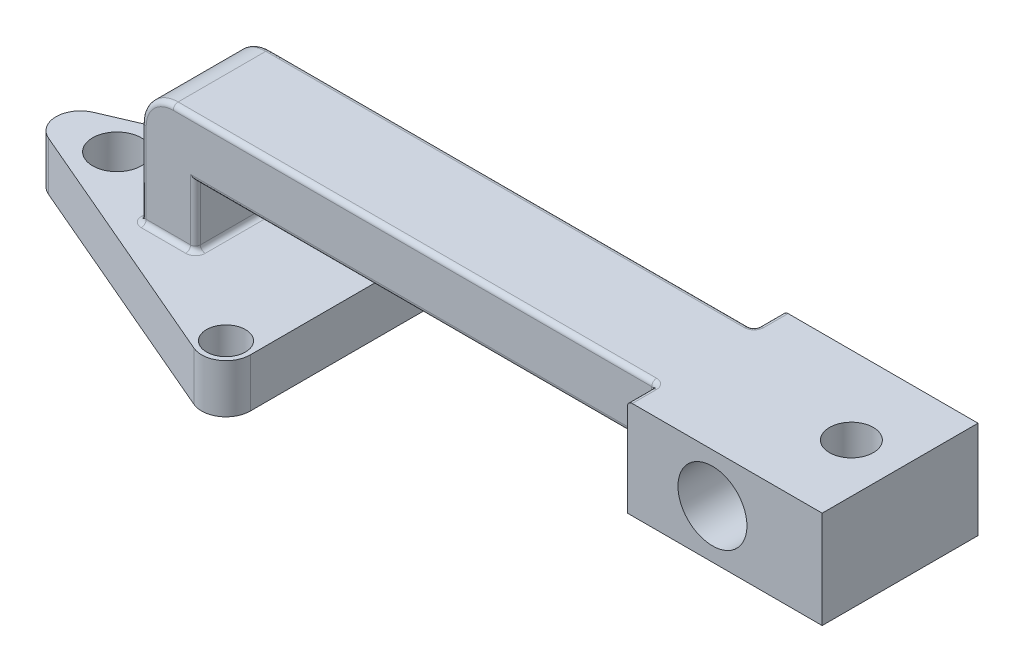
from build123d import *

# Parameters (mm, degrees)
BOSS_EXTRUDE1_DEPTH = 10
FILLET1_R           = 5
SKETCH2_R           = 5
SKETCH2_R_2         = 4
CUT_EXTRUDE1_DEPTH  = 20
BOSS_EXTRUDE2_DEPTH = 10
SKETCH6_W           = 32
SKETCH6_H           = 20
BOSS_EXTRUDE3_DEPTH = 40
SKETCH8_R           = 7.085047893
CUT_EXTRUDE3_DEPTH  = 40
FILLET5_R           = 1
SKETCH9_R           = 4.5
CUT_EXTRUDE4_DEPTH  = 40


with BuildPart() as part:
    # Sketch1 → Boss-Extrude1 (new body)
    with BuildSketch(Plane(origin=(0, 0, 0), x_dir=(1, 0, 0), z_dir=(0, 1, 0))):
        Polygon((0, 30), (0, -30), (-70, 0), align=None)
    extrude(amount=BOSS_EXTRUDE1_DEPTH)

    # Fillet1
    fillet1_edges = [part.edges().sort_by_distance(p)[0] for p in [
        (-70, 5, 0),
        (0, 5, -30),
        (0, 5, 30),
    ]]
    fillet(fillet1_edges, radius=FILLET1_R)

    # Sketch2 → Cut-Extrude1 (cut)
    with BuildSketch(Plane(origin=(0, 10, 0), x_dir=(1, 0, 0), z_dir=(0, 1, 0))):
        with Locations((-49.802086297, 0)):
            Circle(SKETCH2_R)
        with Locations((-5, -22.417304924)):
            Circle(SKETCH2_R_2)
        with Locations((-5, 20.850130455)):
            Circle(SKETCH2_R_2)
    extrude(amount=-CUT_EXTRUDE1_DEPTH, mode=Mode.SUBTRACT)

    # Sketch5 → Boss-Extrude2 (add, symmetric)
    with BuildSketch(Plane.XY):
        with BuildLine():
            Line((-34.802086297, 10), (-34.802086297, 27.593137539))
            ThreePointArc((-34.802086297, 27.593137539), (-32.882138895, 32.228300597), (-28.246975837, 34.148247999))
            Line((-28.246975837, 34.148247999), (71.019925529, 34.148247999))
            Line((71.019925529, 34.148247999), (71.019925529, 22.548960845))
            Line((71.019925529, 22.548960845), (-23.685050469, 22.548960845))
            Line((-23.685050469, 22.548960845), (-23.685050469, 10))
            Line((-23.685050469, 10), (-34.802086297, 10))
        make_face()
    extrude(amount=BOSS_EXTRUDE2_DEPTH, both=True)

    # Sketch6 → Boss-Extrude3 (add)
    with BuildSketch(Plane(origin=(71.019925529, 0, 0), x_dir=(0, 0, -1), z_dir=(1, 0, 0))):
        with Locations((0, 24.148247999)):
            Rectangle(SKETCH6_W, SKETCH6_H)
    extrude(amount=BOSS_EXTRUDE3_DEPTH)

    # Sketch8 → Cut-Extrude3 (cut)
    with BuildSketch(Plane.XY.offset(16)):
        with Locations((88.486957475, 24.148247999)):
            Circle(SKETCH8_R)
    extrude(amount=-CUT_EXTRUDE3_DEPTH, mode=Mode.SUBTRACT)

    # Fillet5
    fillet5_edges = [part.edges().sort_by_distance(p)[0] for p in [
        (-29.243568383, 10, -10),
        (-34.802086297, 10, 0),
        (-23.685050469, 10, 0),
        (71.019925529, 34.148247999, -13),
        (71.019925529, 22.548960845, 0),
        (71.019925529, 34.148247999, 13),
        (-34.802086297, 18.79656877, -10),
        (-34.802086297, 18.79656877, 10),
        (-32.882138895, 32.228300597, 10),
        (-29.243568383, 10, 10),
        (-23.685050469, 16.274480422, -10),
        (23.66743753, 22.548960845, -10),
        (-32.882138895, 32.228300597, -10),
        (21.386474846, 34.148247999, -10),
        (-23.685050469, 16.274480422, 10),
        (23.66743753, 22.548960845, 10),
        (21.386474846, 34.148247999, 10),
        (71.019925529, 28.348604422, -10),
        (71.019925529, 28.348604422, 10),
    ]]
    fillet(fillet5_edges, radius=FILLET5_R)

    # Sketch9 → Cut-Extrude4 (cut)
    with BuildSketch(Plane(origin=(0, 34.148247999, 0), x_dir=(1, 0, 0), z_dir=(0, 1, 0))):
        with Locations((101.019925529, 0)):
            Circle(SKETCH9_R)
    extrude(amount=-CUT_EXTRUDE4_DEPTH, mode=Mode.SUBTRACT)


solid = part.part
